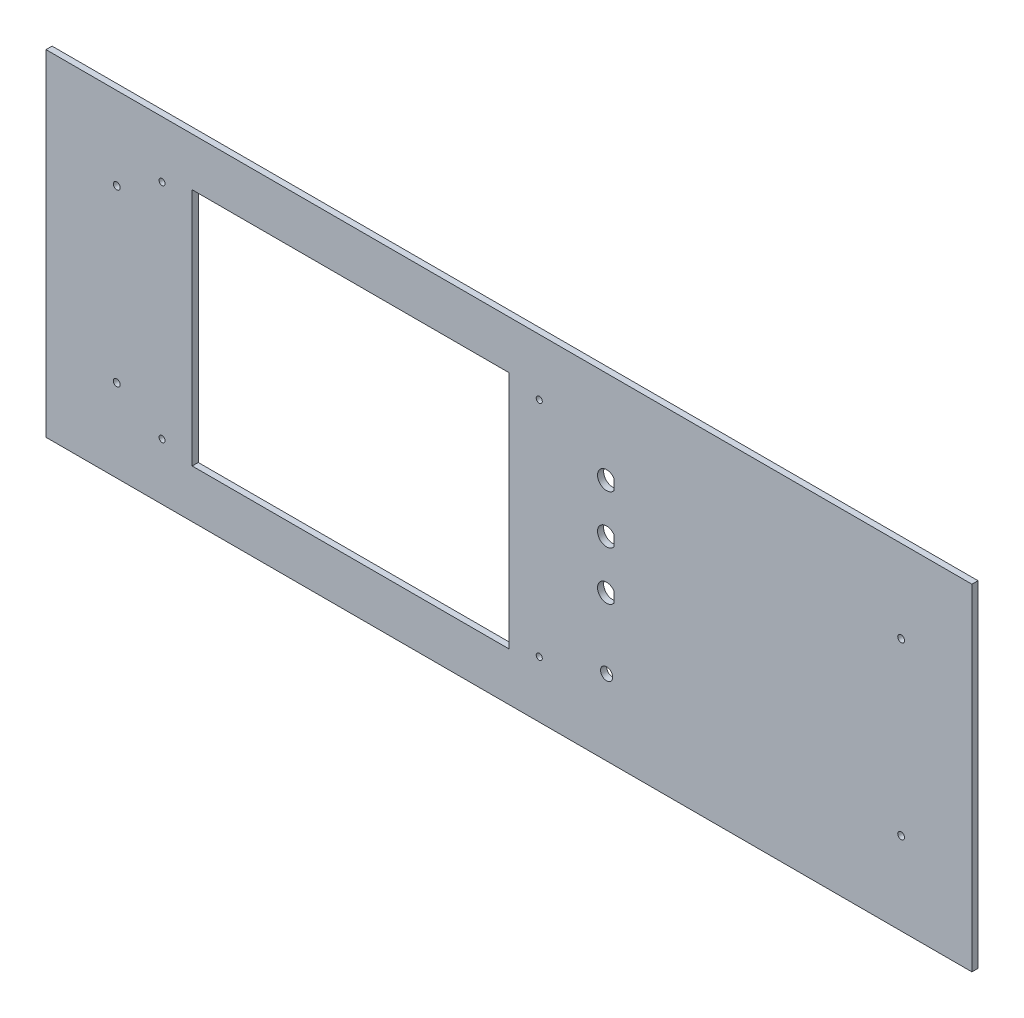
from build123d import *

# Parameters (mm, degrees)
SKETCH1_W                    = 482.6
SKETCH1_H                    = 175.006
BASE_FLANGE_DEPTH            = 3.175
SKETCH2_W                    = 165.2016
SKETCH2_H                    = 124.6886
CUT_EXTRUDE1_DEPTH           = 514.361413296
F_1_8_0_125_DIAMETER_HOLE1_D = 3.175
LPATTERN1_COUNT              = 2
LPATTERN1_PITCH              = 116.0018
LPATTERN1_COUNT_DIR2         = 2
LPATTERN1_PITCH_DIR2         = 196.596
CUT_EXTRUDE2_DEPTH           = 514.361413296
LPATTERN2_COUNT              = 3
LPATTERN2_PITCH              = 25.4
SKETCH5_R                    = 3.175
CUT_EXTRUDE3_DEPTH           = 514.361413296
LPATTERN3_COUNT              = 2
LPATTERN3_PITCH              = 408.8384
LPATTERN3_COUNT_DIR2         = 2
LPATTERN3_PITCH_DIR2         = 88.9


# Sheet-metal steps are written as plain solids
with BuildPart() as part:
    # Sketch1 → Base-Flange (new body)
    with BuildSketch(Plane.XY):
        with Locations((241.3, 87.503)):
            Rectangle(SKETCH1_W, SKETCH1_H)
    extrude(amount=BASE_FLANGE_DEPTH)

    # Sketch2 → Cut-Extrude1 (cut, through all)
    with BuildSketch(Plane.XY.offset(3.175)):
        with Locations((158.8008, 87.503)):
            Rectangle(SKETCH2_W, SKETCH2_H)
    extrude(amount=-CUT_EXTRUDE1_DEPTH, mode=Mode.SUBTRACT)

    # 1/8 (0.125) Diameter Hole1 (through all)
    with Locations(Plane(origin=(60.5028, 29.5021, 3.175), x_dir=(1, 0, 0), z_dir=(0, 0, 1))):
        with Locations((0, 0)):
            f_1_8_0_125_diameter_hole1 = Hole(F_1_8_0_125_DIAMETER_HOLE1_D / 2)

    # LPattern1: 1_8 _0.125_ Diameter Hole1 2 × 2
    with Locations(*[(j * LPATTERN1_PITCH_DIR2, i * LPATTERN1_PITCH, 0) for i in range(LPATTERN1_COUNT) for j in range(LPATTERN1_COUNT_DIR2) if (i, j) != (0, 0)]):
        add(f_1_8_0_125_diameter_hole1, mode=Mode.SUBTRACT)

    # Sketch4 → Cut-Extrude2 (cut, through all)
    with BuildSketch(Plane.XY.offset(3.175)):
        with BuildLine():
            Line((296.1513, 73.343363249), (296.1513, 78.574036751))
            ThreePointArc((296.1513, 78.574036751), (287.4645, 75.9587), (296.1513, 73.343363249))
        make_face()
    cut_extrude2 = extrude(amount=-CUT_EXTRUDE2_DEPTH, mode=Mode.SUBTRACT)

    # LPattern2: Cut-Extrude2 ×3
    with Locations(*[(0, i * LPATTERN2_PITCH, 0) for i in range(1, LPATTERN2_COUNT)]):
        add(cut_extrude2, mode=Mode.SUBTRACT)

    # Sketch5 → Cut-Extrude3 (cut, through all)
    with BuildSketch(Plane.XY.offset(3.175)):
        with Locations((292.2016, 39.3827)):
            Circle(SKETCH5_R)
    extrude(amount=-CUT_EXTRUDE3_DEPTH, mode=Mode.SUBTRACT)

    # Sketch6 → #40 (0.098) Diameter Hole1 (revolve, cut)
    with BuildSketch(Plane(origin=(36.8808, 43.053, 3.175), x_dir=(0, -1, 0), z_dir=(1, 0, 0))):
        Polygon((0, 0), (0, 4.192530181), (1.778, 3.1242), (1.778, 0), align=None)
    f_40_0_098_diameter_hole1 = revolve(axis=Axis((36.8808, 43.053, 9.525), (0, 0, -1)), mode=Mode.SUBTRACT)

    # LPattern3: 40 _0.098_ Diameter Hole1 2 × 2
    with Locations(*[(i * LPATTERN3_PITCH, j * LPATTERN3_PITCH_DIR2, 0) for i in range(LPATTERN3_COUNT) for j in range(LPATTERN3_COUNT_DIR2) if (i, j) != (0, 0)]):
        add(f_40_0_098_diameter_hole1, mode=Mode.SUBTRACT)


solid = part.part
